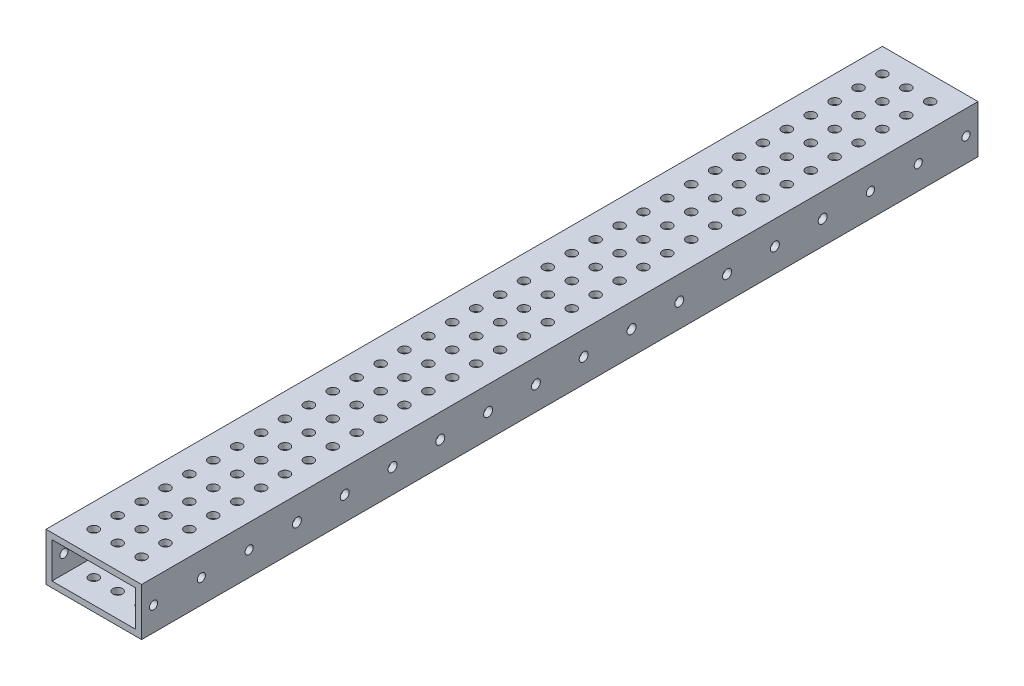
from build123d import *

# Parameters (mm, degrees)
SKETCH1_W           = 50.8
SKETCH1_H           = 25.4
SKETCH1_W_2         = 44.45
SKETCH1_H_2         = 19.05
BOSS_EXTRUDE1_DEPTH = 222.25
SKETCH2_R           = 2.5527
CUT_EXTRUDE1_DEPTH  = 226.134143346
SKETCH3_R           = 2.159
CUT_EXTRUDE2_DEPTH  = 229.335263374
SKETCH4_R           = 2.38125
CUT_EXTRUDE3_DEPTH  = 229.335263374


with BuildPart() as part:
    # Sketch1 → Boss-Extrude1 (new, symmetric)
    with BuildSketch(Plane.XY):
        Rectangle(SKETCH1_W, SKETCH1_H)
        Rectangle(SKETCH1_W_2, SKETCH1_H_2, mode=Mode.SUBTRACT)
    extrude(amount=BOSS_EXTRUDE1_DEPTH, both=True)

    # Sketch2 → Cut-Extrude1 (cut, through all)
    with BuildSketch(Plane(origin=(0, 12.7, 0), x_dir=(1, 0, 0), z_dir=(0, 1, 0))):
        with Locations((0, -209.55)):
            Circle(SKETCH2_R)
        with Locations((12.7, -209.55)):
            Circle(SKETCH2_R)
        with Locations((-12.7, -209.55)):
            Circle(SKETCH2_R)
        with Locations((-12.7, -196.85)):
            Circle(SKETCH2_R)
        with Locations((0, -196.85)):
            Circle(SKETCH2_R)
        with Locations((12.7, -196.85)):
            Circle(SKETCH2_R)
        with Locations((-12.7, -184.15)):
            Circle(SKETCH2_R)
        with Locations((0, -184.15)):
            Circle(SKETCH2_R)
        with Locations((12.7, -184.15)):
            Circle(SKETCH2_R)
        with Locations((-12.7, -171.45)):
            Circle(SKETCH2_R)
        with Locations((0, -171.45)):
            Circle(SKETCH2_R)
        with Locations((12.7, -171.45)):
            Circle(SKETCH2_R)
        with Locations((-12.7, -158.75)):
            Circle(SKETCH2_R)
        with Locations((0, -158.75)):
            Circle(SKETCH2_R)
        with Locations((12.7, -158.75)):
            Circle(SKETCH2_R)
        with Locations((-12.7, -146.05)):
            Circle(SKETCH2_R)
        with Locations((0, -146.05)):
            Circle(SKETCH2_R)
        with Locations((12.7, -146.05)):
            Circle(SKETCH2_R)
        with Locations((-12.7, -133.35)):
            Circle(SKETCH2_R)
        with Locations((0, -133.35)):
            Circle(SKETCH2_R)
        with Locations((12.7, -133.35)):
            Circle(SKETCH2_R)
        with Locations((-12.7, -120.65)):
            Circle(SKETCH2_R)
        with Locations((0, -120.65)):
            Circle(SKETCH2_R)
        with Locations((12.7, -120.65)):
            Circle(SKETCH2_R)
        with Locations((-12.7, -107.95)):
            Circle(SKETCH2_R)
        with Locations((0, -107.95)):
            Circle(SKETCH2_R)
        with Locations((12.7, -107.95)):
            Circle(SKETCH2_R)
        with Locations((-12.7, -95.25)):
            Circle(SKETCH2_R)
        with Locations((0, -95.25)):
            Circle(SKETCH2_R)
        with Locations((12.7, -95.25)):
            Circle(SKETCH2_R)
        with Locations((-12.7, -82.55)):
            Circle(SKETCH2_R)
        with Locations((0, -82.55)):
            Circle(SKETCH2_R)
        with Locations((12.7, -82.55)):
            Circle(SKETCH2_R)
        with Locations((-12.7, -69.85)):
            Circle(SKETCH2_R)
        with Locations((0, -69.85)):
            Circle(SKETCH2_R)
        with Locations((12.7, -69.85)):
            Circle(SKETCH2_R)
        with Locations((-12.7, -57.15)):
            Circle(SKETCH2_R)
        with Locations((0, -57.15)):
            Circle(SKETCH2_R)
        with Locations((12.7, -57.15)):
            Circle(SKETCH2_R)
        with Locations((-12.7, -44.45)):
            Circle(SKETCH2_R)
        with Locations((0, -44.45)):
            Circle(SKETCH2_R)
        with Locations((12.7, -44.45)):
            Circle(SKETCH2_R)
        with Locations((-12.7, -31.75)):
            Circle(SKETCH2_R)
        with Locations((0, -31.75)):
            Circle(SKETCH2_R)
        with Locations((12.7, -31.75)):
            Circle(SKETCH2_R)
        with Locations((-12.7, -19.05)):
            Circle(SKETCH2_R)
        with Locations((0, -19.05)):
            Circle(SKETCH2_R)
        with Locations((12.7, -19.05)):
            Circle(SKETCH2_R)
        with Locations((-12.7, -6.35)):
            Circle(SKETCH2_R)
        with Locations((0, -6.35)):
            Circle(SKETCH2_R)
        with Locations((12.7, -6.35)):
            Circle(SKETCH2_R)
        with Locations((-12.7, 6.35)):
            Circle(SKETCH2_R)
        with Locations((0, 6.35)):
            Circle(SKETCH2_R)
        with Locations((12.7, 6.35)):
            Circle(SKETCH2_R)
        with Locations((-12.7, 19.05)):
            Circle(SKETCH2_R)
        with Locations((0, 19.05)):
            Circle(SKETCH2_R)
        with Locations((12.7, 19.05)):
            Circle(SKETCH2_R)
        with Locations((-12.7, 31.75)):
            Circle(SKETCH2_R)
        with Locations((0, 31.75)):
            Circle(SKETCH2_R)
        with Locations((12.7, 31.75)):
            Circle(SKETCH2_R)
        with Locations((-12.7, 44.45)):
            Circle(SKETCH2_R)
        with Locations((0, 44.45)):
            Circle(SKETCH2_R)
        with Locations((12.7, 44.45)):
            Circle(SKETCH2_R)
        with Locations((-12.7, 57.15)):
            Circle(SKETCH2_R)
        with Locations((0, 57.15)):
            Circle(SKETCH2_R)
        with Locations((12.7, 57.15)):
            Circle(SKETCH2_R)
        with Locations((-12.7, 69.85)):
            Circle(SKETCH2_R)
        with Locations((0, 69.85)):
            Circle(SKETCH2_R)
        with Locations((12.7, 69.85)):
            Circle(SKETCH2_R)
        with Locations((-12.7, 82.55)):
            Circle(SKETCH2_R)
        with Locations((0, 82.55)):
            Circle(SKETCH2_R)
        with Locations((12.7, 82.55)):
            Circle(SKETCH2_R)
        with Locations((-12.7, 95.25)):
            Circle(SKETCH2_R)
        with Locations((0, 95.25)):
            Circle(SKETCH2_R)
        with Locations((12.7, 95.25)):
            Circle(SKETCH2_R)
        with Locations((-12.7, 107.95)):
            Circle(SKETCH2_R)
        with Locations((0, 107.95)):
            Circle(SKETCH2_R)
        with Locations((12.7, 107.95)):
            Circle(SKETCH2_R)
        with Locations((-12.7, 120.65)):
            Circle(SKETCH2_R)
        with Locations((0, 120.65)):
            Circle(SKETCH2_R)
        with Locations((12.7, 120.65)):
            Circle(SKETCH2_R)
        with Locations((-12.7, 133.35)):
            Circle(SKETCH2_R)
        with Locations((0, 133.35)):
            Circle(SKETCH2_R)
        with Locations((12.7, 133.35)):
            Circle(SKETCH2_R)
        with Locations((-12.7, 146.05)):
            Circle(SKETCH2_R)
        with Locations((0, 146.05)):
            Circle(SKETCH2_R)
        with Locations((12.7, 146.05)):
            Circle(SKETCH2_R)
        with Locations((-12.7, 158.75)):
            Circle(SKETCH2_R)
        with Locations((0, 158.75)):
            Circle(SKETCH2_R)
        with Locations((12.7, 158.75)):
            Circle(SKETCH2_R)
        with Locations((-12.7, 171.45)):
            Circle(SKETCH2_R)
        with Locations((0, 171.45)):
            Circle(SKETCH2_R)
        with Locations((12.7, 171.45)):
            Circle(SKETCH2_R)
        with Locations((-12.7, 184.15)):
            Circle(SKETCH2_R)
        with Locations((0, 184.15)):
            Circle(SKETCH2_R)
        with Locations((12.7, 184.15)):
            Circle(SKETCH2_R)
        with Locations((-12.7, 196.85)):
            Circle(SKETCH2_R)
        with Locations((0, 196.85)):
            Circle(SKETCH2_R)
        with Locations((12.7, 196.85)):
            Circle(SKETCH2_R)
        with Locations((-12.7, 209.55)):
            Circle(SKETCH2_R)
        with Locations((0, 209.55)):
            Circle(SKETCH2_R)
        with Locations((12.7, 209.55)):
            Circle(SKETCH2_R)
    extrude(amount=-CUT_EXTRUDE1_DEPTH, mode=Mode.SUBTRACT)

    # Sketch3 → Cut-Extrude2 (cut, through all)
    with BuildSketch(Plane(origin=(25.4, 0, 0), x_dir=(0, 0, -1), z_dir=(1, 0, 0))):
        with Locations((-215.9, 0)):
            Circle(SKETCH3_R)
        with Locations((-190.5, 0)):
            Circle(SKETCH3_R)
        with Locations((-165.1, 0)):
            Circle(SKETCH3_R)
        with Locations((215.9, 0)):
            Circle(SKETCH3_R)
        with Locations((190.5, 0)):
            Circle(SKETCH3_R)
        with Locations((165.1, 0)):
            Circle(SKETCH3_R)
    extrude(amount=-CUT_EXTRUDE2_DEPTH, mode=Mode.SUBTRACT)

    # Sketch4 → Cut-Extrude3 (cut, through all)
    with BuildSketch(Plane(origin=(25.4, 0, 0), x_dir=(0, 0, -1), z_dir=(1, 0, 0))):
        with Locations((-139.7, 0)):
            Circle(SKETCH4_R)
        with Locations((-114.3, 0)):
            Circle(SKETCH4_R)
        with Locations((-88.9, 0)):
            Circle(SKETCH4_R)
        with Locations((-63.5, 0)):
            Circle(SKETCH4_R)
        with Locations((-38.1, 0)):
            Circle(SKETCH4_R)
        with Locations((-12.7, 0)):
            Circle(SKETCH4_R)
        with Locations((12.7, 0)):
            Circle(SKETCH4_R)
        with Locations((38.1, 0)):
            Circle(SKETCH4_R)
        with Locations((63.5, 0)):
            Circle(SKETCH4_R)
        with Locations((88.9, 0)):
            Circle(SKETCH4_R)
        with Locations((114.3, 0)):
            Circle(SKETCH4_R)
        with Locations((139.7, 0)):
            Circle(SKETCH4_R)
    extrude(amount=-CUT_EXTRUDE3_DEPTH, mode=Mode.SUBTRACT)


solid = part.part
